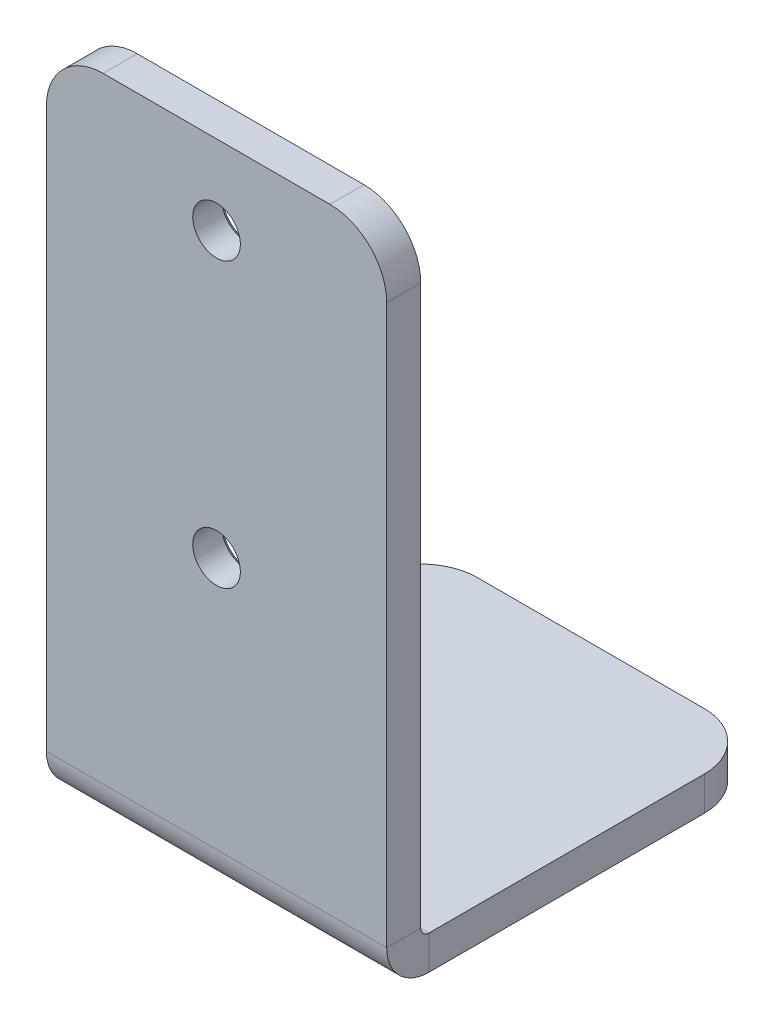
from build123d import *

# Parameters (mm, degrees)
BASE_FLANGE1_DEPTH          = 15
M5_TAPPED_HOLE1_D           = 4.2
M5_TAPPED_HOLE1_DEPTH       = 14
M5_TAPPED_HOLE1_CSINK_D     = 5.05
M5_TAPPED_HOLE1_CSINK_ANGLE = 90
M5_TAPPED_HOLE1_TIP         = 1.2618073
FILLET1_R                   = 5


# Sheet-metal steps are written as plain solids
with BuildPart() as part:
    # Sketch1 → Base-Flange1 (new, symmetric)
    with BuildSketch(Plane(origin=(0, 0, 0), x_dir=(0, 0, -1), z_dir=(1, 0, 0))):
        with BuildLine():
            Line((0, 0), (0, -54.2634))
            ThreePointArc((0, -54.2634), (0.215745145, -54.784254855), (0.7366, -55))
            Line((0.7366, -55), (30, -55))
            Line((30, -55), (30, -58))
            Line((30, -58), (0.7366, -58))
            ThreePointArc((0.7366, -58), (-1.905575199, -56.905575199), (-3, -54.2634))
            Line((-3, -54.2634), (-3, 0))
            Line((-3, 0), (0, 0))
        make_face()
    extrude(amount=BASE_FLANGE1_DEPTH, both=True)

    # M5 Tapped Hole1
    with Locations(Plane(origin=(0, 0, 0), x_dir=(-1, 0, 0), z_dir=(0, 0, -1))):
        with Locations((0, -32), (0, -7)):
            CounterSinkHole(M5_TAPPED_HOLE1_D / 2, M5_TAPPED_HOLE1_CSINK_D / 2, depth=M5_TAPPED_HOLE1_DEPTH, counter_sink_angle=M5_TAPPED_HOLE1_CSINK_ANGLE)
            with Locations((0, 0, -(M5_TAPPED_HOLE1_DEPTH + M5_TAPPED_HOLE1_TIP / 2))):  # 118° drill point
                Cone(0, M5_TAPPED_HOLE1_D / 2, M5_TAPPED_HOLE1_TIP, mode=Mode.SUBTRACT)

    # Fillet1
    fillet1_edges = [part.edges().sort_by_distance(p)[0] for p in [
        (15, 0, 1.5),
        (-15, 0, 1.5),
        (15, -56.5, -30),
        (-15, -56.5, -30),
    ]]
    fillet(fillet1_edges, radius=FILLET1_R)


solid = part.part
